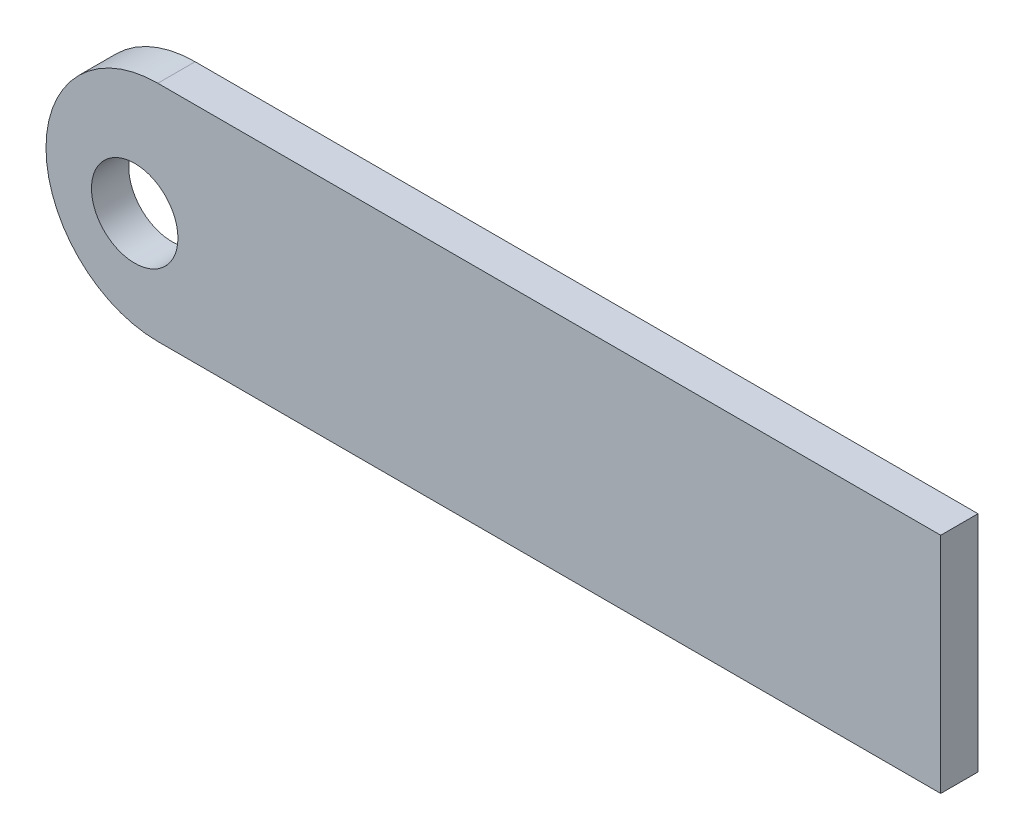
from build123d import *

# Parameters (mm, degrees)
SKETCH1_W           = 76.2
SKETCH1_H           = 19.05
BOSS_EXTRUDE1_DEPTH = 3.175
FILLET1_R           = 9.525
SKETCH2_R           = 3.683
CUT_EXTRUDE1_DEPTH  = 79.60930686


with BuildPart() as part:
    # Sketch1 → Boss-Extrude1 (new body)
    with BuildSketch(Plane.XY):
        with Locations((38.1, 9.525)):
            Rectangle(SKETCH1_W, SKETCH1_H)
    extrude(amount=BOSS_EXTRUDE1_DEPTH)

    # Fillet1
    fillet1_edges = [part.edges().sort_by_distance(p)[0] for p in [
        (0, 0, 1.5875),
        (0, 19.05, 1.5875),
    ]]
    fillet(fillet1_edges, radius=FILLET1_R - 0.0001)  # a hair under: the kernel refuses the full size

    # Sketch2 → Cut-Extrude1 (cut, through all)
    with BuildSketch(Plane.XY.offset(3.175)):
        with Locations((7.553506199, 8.47367626)):
            Circle(SKETCH2_R)
    extrude(amount=-CUT_EXTRUDE1_DEPTH, mode=Mode.SUBTRACT)


solid = part.part
